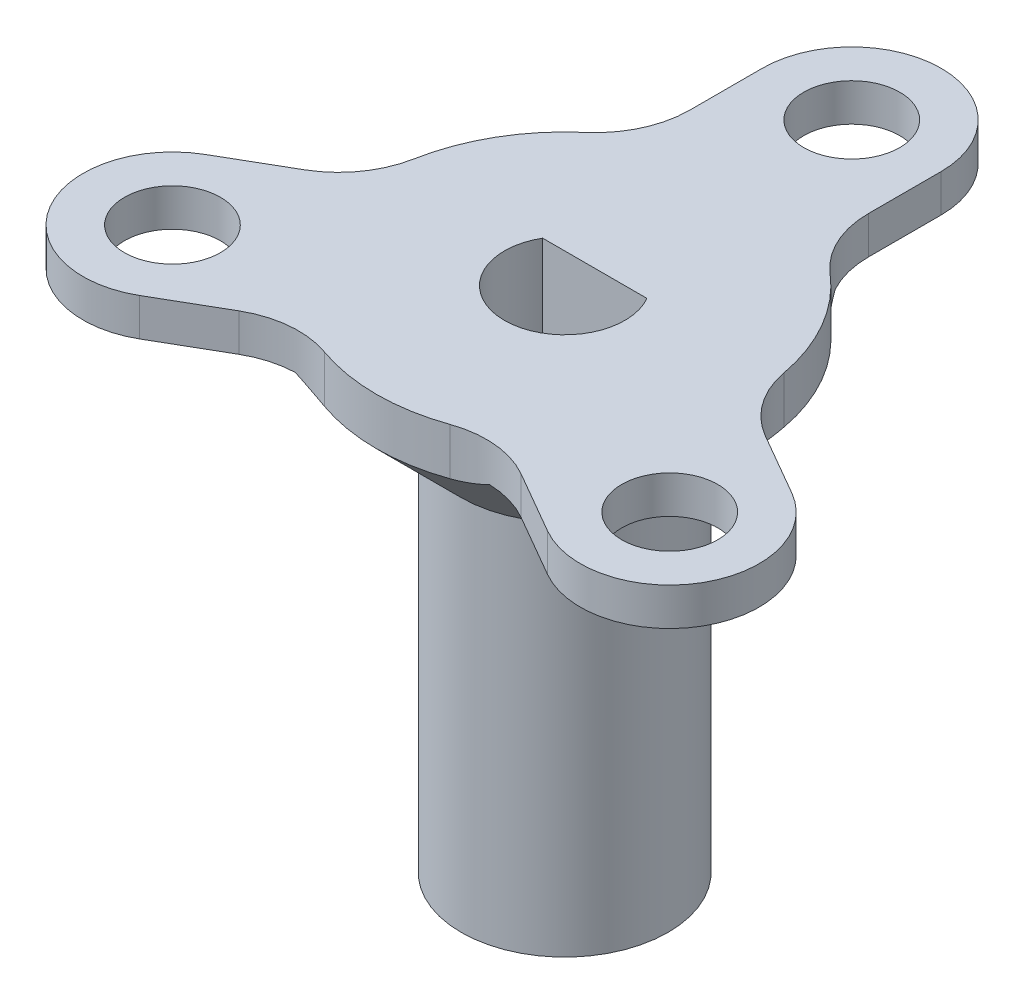
from build123d import *
from build123d.topology import SkipClean

# Parameters (mm, degrees)
SKETCH1_R               = 10
BOSS_EXTRUDE1_DEPTH     = 2
BOSS_EXTRUDE2_START     = -2
SKETCH2_R               = 2.55
BOSS_EXTRUDE2_DEPTH     = 2
CIRPATTERN1_COUNT       = 3
CUT_EXTRUDE1_DEPTH      = 27.9527328
SKETCH4_R               = 5.5
BOSS_EXTRUDE3_DEPTH     = 25
CUT_EXTRUDE2_START      = -7
SKETCH5_R               = 3
CUT_EXTRUDE2_DEPTH      = 7
CUT_EXTRUDE3_DEPTH      = 34.502982037
CUT_EXTRUDE3_DEPTH_BACK = 34.502982037
CUT_EXTRUDE4_START      = -7
SKETCH8_R               = 3.2
CUT_EXTRUDE4_DEPTH      = 7
FILLET2_R               = 5
CHAMFER1_START          = -2
CHAMFER1_2_DEPTH        = 2


with BuildPart() as part:
    # Sketch1 → Boss-Extrude1 (new body)
    with BuildSketch(Plane(origin=(0, 0, 0), x_dir=(1, 0, 0), z_dir=(0, 1, 0))):
        with Locations(Location((0, 0, 0), (0, 0, 270))):
            Circle(SKETCH1_R)
    extrude(amount=BOSS_EXTRUDE1_DEPTH)

    # Sketch2 → Boss-Extrude2 (add)
    with BuildSketch(Plane(origin=(0, 2, 0), x_dir=(1, 0, 0), z_dir=(0, 1, 0)).offset(BOSS_EXTRUDE2_START)):
        with BuildLine():
            Line((-4.75, 15.25), (-4.75, 8.799857953))
            ThreePointArc((-4.75, 8.799857953), (0, 10), (4.75, 8.799857953))
            Line((4.75, 8.799857953), (4.75, 15.25))
            ThreePointArc((4.75, 15.25), (0, 20), (-4.75, 15.25))
        make_face()
        with Locations(Location((0, 15.25, 0), (0, 0, 270))):
            Circle(SKETCH2_R, mode=Mode.SUBTRACT)
    boss_extrude2 = extrude(amount=BOSS_EXTRUDE2_DEPTH)

    # CirPattern1: Boss-Extrude2 ×3 about axis
    cirpattern1_axis = Axis((0, 0, 0), (0, 1, 0))
    for i in range(1, CIRPATTERN1_COUNT):
        add(boss_extrude2.rotate(cirpattern1_axis, i * 360 / CIRPATTERN1_COUNT))

    # Sketch3 → Cut-Extrude1 (cut, through all)
    with BuildSketch(Plane(origin=(0, 2, 0), x_dir=(1, 0, 0), z_dir=(0, 1, 0))):
        with BuildLine():
            Line((-2.653299832, 1.4), (2.653299832, 1.4))
            ThreePointArc((2.653299832, 1.4), (0, -3), (-2.653299832, 1.4))
        make_face()
    extrude(amount=-CUT_EXTRUDE1_DEPTH, mode=Mode.SUBTRACT)

    # Sketch4 → Boss-Extrude3 (add)
    with SkipClean():  # the faces are left unmerged after this step: merging them gives an invalid solid
        with BuildSketch(Plane.XZ):
            with Locations(Location((0, 0, 0), (0, 0, 90))):
                Circle(SKETCH4_R)
            with BuildLine():
                Line((2.653299832, -1.4), (-2.653299832, -1.4))
                ThreePointArc((-2.653299832, -1.4), (0, 3), (2.653299832, -1.4))
            make_face(mode=Mode.SUBTRACT)
        extrude(amount=BOSS_EXTRUDE3_DEPTH)

    # Sketch5 → Cut-Extrude2 (cut)
    with SkipClean():  # the faces are left unmerged after this step: merging them gives an invalid solid
        with BuildSketch(Plane.XZ.offset(25).offset(CUT_EXTRUDE2_START)):
            with Locations(Location((0, 0, 0), (0, 0, 332.181860715))):
                Circle(SKETCH5_R)
        extrude(amount=CUT_EXTRUDE2_DEPTH, mode=Mode.SUBTRACT)

    # Sketch7 → Cut-Extrude3 (cut, two sides: drawn at the far end of the back side and taken through both)
    with BuildSketch(Plane.XZ.offset(18).offset(-CUT_EXTRUDE3_DEPTH_BACK)):
        with BuildLine():
            Line((2.771281292, -1.6), (-2.771281292, -1.6))
            ThreePointArc((-2.771281292, -1.6), (0, 3.2), (2.771281292, -1.6))
        make_face()
        with BuildLine():
            Line((2.653299832, -1.4), (-2.653299832, -1.4))
            ThreePointArc((-2.653299832, -1.4), (0, 3), (2.653299832, -1.4))
        make_face(mode=Mode.SUBTRACT)
    extrude(amount=CUT_EXTRUDE3_DEPTH + CUT_EXTRUDE3_DEPTH_BACK, mode=Mode.SUBTRACT)

    # Sketch8 → Cut-Extrude4 (cut)
    with BuildSketch(Plane.XZ.offset(25).offset(CUT_EXTRUDE4_START)):
        with Locations(Location((0, 0, 0), (0, 0, 270))):
            Circle(SKETCH8_R)
    extrude(amount=CUT_EXTRUDE4_DEPTH, mode=Mode.SUBTRACT)

    # Fillet2
    fillet2_edges = [part.edges().sort_by_distance(p)[0] for p in [
        (9.995900537, 1, 0.286308309),
        (5.245900537, 1, 8.513549645),
        (-5.245900537, 1, 8.513549645),
        (-9.995900537, 1, 0.286308309),
        (-4.75, 1, -8.799857953),
        (4.75, 1, -8.799857953),
    ]]
    fillet(fillet2_edges, radius=FILLET2_R)

    # Chamfer1: read off the stored shape, not the designer's step
    # Chamfer1 outline → Chamfer1 (revolve)
    with BuildSketch(Plane.XY):
        Polygon((5.5, 0), (5.5, -5), (10.5, 0), align=None)
    revolve(axis=Axis((0, 0, 0), (0, 1, 0)))

    # Chamfer1 2 outline → Chamfer1 2 (cut)
    with BuildSketch(Plane(origin=(0, 0, 0), x_dir=(1, 0, 0), z_dir=(0, 1, 0)).offset(CHAMFER1_START)):
        with BuildLine():
            ThreePointArc((7.496834936, -9.813127226), (5.456150608, -9.164396031), (3.331223291, -9.428836163))
            ThreePointArc((3.331223291, -9.428836163), (0, -10), (-3.331223291, -9.428836163))
            ThreePointArc((-3.331223291, -9.428836163), (-5.456150608, -9.164396031), (-7.496834936, -9.813127226))
            Line((-7.496834936, -9.813127226), (-11.28460969, -12))
            Line((-11.28460969, -12), (11.28460969, -12))
            Line((11.28460969, -12), (7.496834936, -9.813127226))
        make_face()
        with BuildLine():
            ThreePointArc((9.831223291, 1.829494086), (10.582663547, -0.023370954), (12, -1.433664786))
            Line((12, -1.433664786), (12, 11))
            Line((12, 11), (4.765946576, 11))
            ThreePointArc((4.765946576, 11), (5.295673168, 9.12767596), (6.5, 7.599342077))
            ThreePointArc((6.5, 7.599342077), (8.660254038, 5), (9.831223291, 1.829494086))
        make_face()
        with BuildLine():
            Line((-12, 11), (-12, -1.433664786))
            ThreePointArc((-12, -1.433664786), (-10.582663547, -0.023370954), (-9.831223291, 1.829494086))
            ThreePointArc((-9.831223291, 1.829494086), (-8.660254038, 5), (-6.5, 7.599342077))
            ThreePointArc((-6.5, 7.599342077), (-5.295673168, 9.12767596), (-4.765946576, 11))
            Line((-4.765946576, 11), (-12, 11))
        make_face()
    extrude(amount=CHAMFER1_2_DEPTH, mode=Mode.SUBTRACT)


solid = part.part
